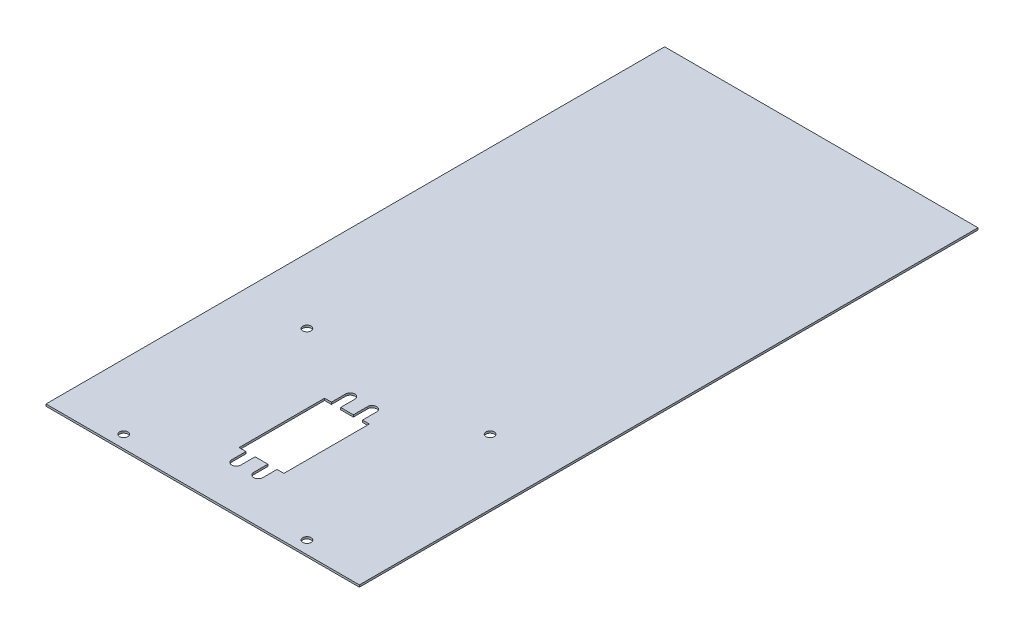
from build123d import *

# Parameters (mm, degrees)
SKETCH1_W               = 154
SKETCH1_H               = 304
BASE_FLANGE1_DEPTH      = 1
SKETCH4_W               = 22
SKETCH4_H               = 42
CUT_EXTRUDE3_DEPTH      = 10
MIRROR2_COPY_1_SKETCH_W = 22
MIRROR2_COPY_1_SKETCH_H = 42
MIRROR2_COPY_1_DEPTH    = 10
SKETCH2_R               = 2.05
CUT_EXTRUDE4_DEPTH      = 10


# Sheet-metal steps are written as plain solids
with BuildPart() as part:
    # Sketch1 → Base-Flange1 (new body)
    with BuildSketch(Plane(origin=(0, 0, 0), x_dir=(1, 0, 0), z_dir=(0, 1, 0))):
        with Locations((0, -117.655376963)):
            Rectangle(SKETCH1_W, SKETCH1_H)
    extrude(amount=-BASE_FLANGE1_DEPTH)

    # Sketch4 → Cut-Extrude3 (cut)
    with BuildSketch(Plane(origin=(0, 0, 0), x_dir=(1, 0, 0), z_dir=(0, 1, 0))):
        with Locations((0, -219.755376963)):
            Rectangle(SKETCH4_W, SKETCH4_H)
        with BuildLine():
            Line((-7.634176778, -205.755376963), (-7.634176778, -191.755376963))
            ThreePointArc((-7.634176778, -191.755376963), (-5.384176778, -189.505376963), (-3.134176778, -191.755376963))
            Line((-3.134176778, -191.755376963), (-3.134176778, -205.755376963))
            ThreePointArc((-3.134176778, -205.755376963), (-5.384176778, -208.005376963), (-7.634176778, -205.755376963))
        make_face()
    cut_extrude3 = extrude(amount=-CUT_EXTRUDE3_DEPTH, mode=Mode.SUBTRACT)

    # Mirror1: Cut-Extrude3 across plane
    add(cut_extrude3.mirror(Plane(origin=(0, 0, 0), x_dir=(0, 0, 1), z_dir=(1, 0, 0))), mode=Mode.SUBTRACT)

    # Mirror2: Cut-Extrude3 across plane
    add(cut_extrude3.mirror(Plane(origin=(0, 0, 219.755376963), x_dir=(1, 0, 0), z_dir=(0, 0, -1))), mode=Mode.SUBTRACT)

    # Mirror2 copy 1 sketch → Mirror2 copy 1 (cut)
    with BuildSketch(Plane(origin=(0, 0, 439.510753926), x_dir=(-1, 0, 0), z_dir=(0, 1, 0))):
        with Locations((0, -219.755376963)):
            Rectangle(MIRROR2_COPY_1_SKETCH_W, MIRROR2_COPY_1_SKETCH_H)
        with BuildLine():
            Line((-7.634176778, -205.755376963), (-7.634176778, -191.755376963))
            ThreePointArc((-7.634176778, -191.755376963), (-5.384176778, -189.505376963), (-3.134176778, -191.755376963))
            Line((-3.134176778, -191.755376963), (-3.134176778, -205.755376963))
            ThreePointArc((-3.134176778, -205.755376963), (-5.384176778, -208.005376963), (-7.634176778, -205.755376963))
        make_face()
    extrude(amount=-MIRROR2_COPY_1_DEPTH, mode=Mode.SUBTRACT)

    # Sketch2 → Cut-Extrude4 (cut)
    with BuildSketch(Plane(origin=(0, 0, 0), x_dir=(1, 0, 0), z_dir=(0, 1, 0))):
        with Locations(Location((-45.02, -263.475376963, 0), (0, 0, 270))):
            Circle(SKETCH2_R)
        with Locations(Location((-45.02, -173.435376963, 0), (0, 0, 270))):
            Circle(SKETCH2_R)
        with Locations(Location((45.02, -173.435376963, 0), (0, 0, 270))):
            Circle(SKETCH2_R)
        with Locations(Location((45.02, -263.475376963, 0), (0, 0, 270))):
            Circle(SKETCH2_R)
    extrude(amount=-CUT_EXTRUDE4_DEPTH, mode=Mode.SUBTRACT)


solid = part.part
